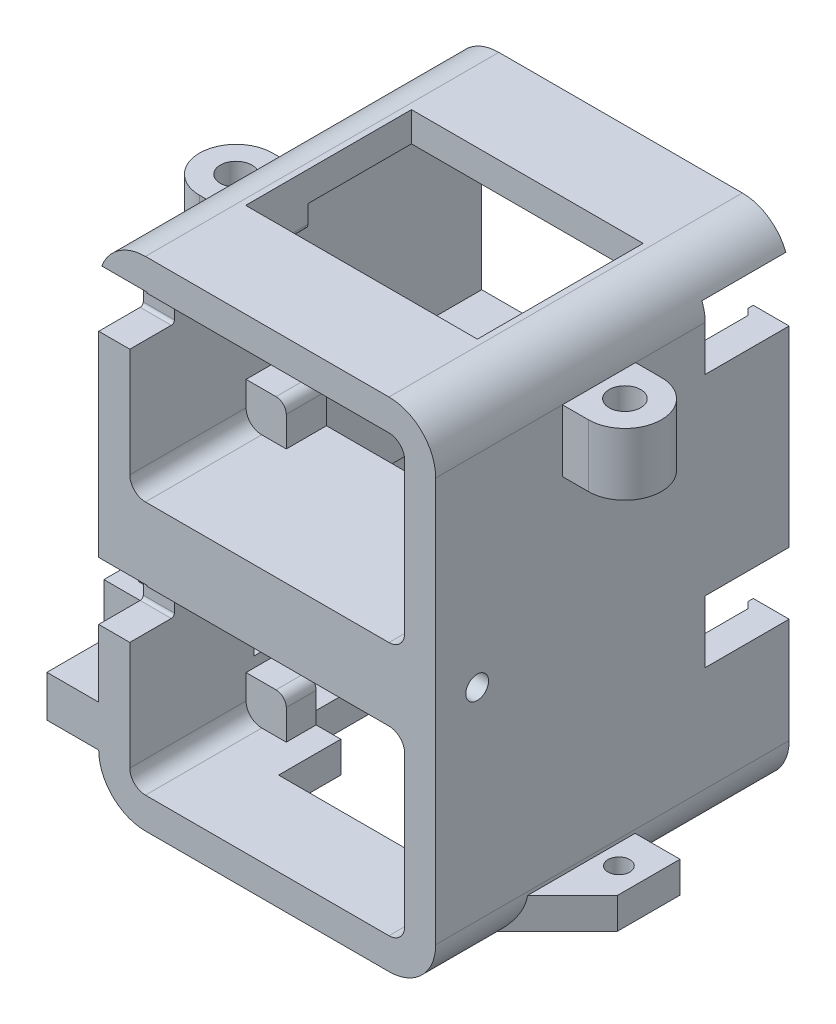
from build123d import *

# Parameters (mm, degrees)
EXTRUDE_2_DEPTH         = 11.22
EXTRUDE_3_DEPTH         = 3.88
CUT_EXTRUDE_1_DEPTH     = 4.65
SKETCH_8_R              = 3.525
SKETCH_8_R_2            = 1.525
EXTRUDE_5_DEPTH         = 6
SKETCH_9_W              = 22.36
SKETCH_9_H              = 3
CUT_EXTRUDE_3_DEPTH     = 6
SKETCH_10_W             = 21.46
SKETCH_10_H             = 6.88
CUT_EXTRUDE_4_DEPTH     = 1
CUT_EXTRUDE_5_DEPTH     = 8
SKETCH_14_W             = 6.38
SKETCH_14_H             = 10.58
EXTRUDE_7_DEPTH         = 3
SKETCH_15_W             = 26.8
SKETCH_15_H             = 42.3
EXTRUDE_42880_DEPTH     = 19
SKETCH_16_W             = 26.8
SKETCH_16_H             = 6.7
EXTRUDE_9_DEPTH         = 16
CUT_EXTRUDE_8_REACH     = 51.071
SKETCH_17_W             = 19.76
SKETCH_17_H             = 10
CUT_EXTRUDE_9_REACH     = 63.246
SKETCH_18_W             = 8.1
SKETCH_18_H             = 6
CUT_EXTRUDE_START       = -2.86
SKETCH_19_W             = 21.46
SKETCH_19_H             = 1
SKETCH_19_H_2           = 10
CUT_EXTRUDE_10_DEPTH    = 2.86
CUT_EXTRUDE_14_REACH    = 64.971
SKETCH_24_W             = 14
SKETCH_24_H             = 6
CUT_EXTRUDE_11_REACH    = 64.971
SKETCH_20_W             = 22.36
SKETCH_20_H             = 10
SKETCH_21_W             = 1.5
SKETCH_21_H             = 5
EXTRUDE_10_DEPTH        = 0.6
CHAMFER_1_SIZE          = 1
CUT_EXTRUDE_46979_REACH = 64.955
SKETCH_22_W             = 8.1
SKETCH_22_H             = 9.56
SKETCH_25_R             = 1.05
EXTRUDE_47426_DEPTH     = 3
SKETCH_26_W             = 5
SKETCH_26_H             = 4
EXTRUDE_12_DEPTH        = 7
SKETCH_27_R             = 1.05
CUT_EXTRUDE_15_DEPTH    = 57.74919682
SKETCH_30_W             = 6.32
SKETCH_30_H             = 5
EXTRUDE_13_DEPTH        = 5
CUT_EXTRUDE_16_REACH    = 58.749
SKETCH_33_W             = 1
SKETCH_33_H             = 1.5
SKETCH_34_W             = 14
SKETCH_34_H             = 1.5
EXTRUDE_14_DEPTH        = 5
FILLET_1_R              = 0.5


with BuildPart() as part:
    # 草图2 → 凸台-拉伸2 (new body)
    with BuildSketch(Plane.XY):
        with BuildLine():
            ThreePointArc((-16.26, -7.25), (-14.939051583, -10.439051583), (-11.75, -11.76))
            Line((-11.75, -11.76), (11.75, -11.76))
            ThreePointArc((11.75, -11.76), (14.939051583, -10.439051583), (16.26, -7.25))
            Line((16.26, -7.25), (16.26, 31.75))
            ThreePointArc((16.26, 31.75), (14.939051583, 34.939051583), (11.75, 36.26))
            Line((11.75, 36.26), (-11.75, 36.26))
            ThreePointArc((-11.75, 36.26), (-14.939051583, 34.939051583), (-16.26, 31.75))
            Line((-16.26, 31.75), (-16.26, -7.25))
        make_face()
        with BuildLine():
            Line((13.26, 7.25), (13.26, -7.25))
            ThreePointArc((13.26, -7.25), (12.81773124, -8.31773124), (11.75, -8.76))
            Line((11.75, -8.76), (-11.75, -8.76))
            ThreePointArc((-11.75, -8.76), (-12.81773124, -8.31773124), (-13.26, -7.25))
            Line((-13.26, -7.25), (-13.26, 7.25))
            ThreePointArc((-13.26, 7.25), (-12.81773124, 8.31773124), (-11.75, 8.76))
            Line((-11.75, 8.76), (11.75, 8.76))
            ThreePointArc((11.75, 8.76), (12.81773124, 8.31773124), (13.26, 7.25))
        make_face(mode=Mode.SUBTRACT)
        with BuildLine():
            Line((-11.75, 33.26), (11.75, 33.26))
            ThreePointArc((11.75, 33.26), (12.81773124, 32.81773124), (13.26, 31.75))
            Line((13.26, 31.75), (13.26, 17.25))
            ThreePointArc((13.26, 17.25), (12.81773124, 16.18226876), (11.75, 15.74))
            Line((11.75, 15.74), (-11.75, 15.74))
            ThreePointArc((-11.75, 15.74), (-12.81773124, 16.18226876), (-13.26, 17.25))
            Line((-13.26, 17.25), (-13.26, 31.75))
            ThreePointArc((-13.26, 31.75), (-12.81773124, 32.81773124), (-11.75, 33.26))
        make_face(mode=Mode.SUBTRACT)
    extrude(amount=-EXTRUDE_2_DEPTH)

    # 草图3 → 凸台-拉伸3 (add)
    with BuildSketch(Plane(origin=(0, 0, -11.22), x_dir=(-1, 0, 0), z_dir=(0, 0, -1))):
        with BuildLine():
            ThreePointArc((11.75, -11.76), (14.939051583, -10.439051583), (16.26, -7.25))
            Line((16.26, -7.25), (16.26, 31.75))
            ThreePointArc((16.26, 31.75), (14.939051583, 34.939051583), (11.75, 36.26))
            Line((11.75, 36.26), (-11.75, 36.26))
            ThreePointArc((-11.75, 36.26), (-14.939051583, 34.939051583), (-16.26, 31.75))
            Line((-16.26, 31.75), (-16.26, -7.25))
            ThreePointArc((-16.26, -7.25), (-14.939051583, -10.439051583), (-11.75, -11.76))
            Line((-11.75, -11.76), (11.75, -11.76))
        make_face()
        with BuildLine():
            Line((13.26, -4.88), (10.37, -4.88))
            ThreePointArc((10.37, -4.88), (9.669964287, -5.169964287), (9.38, -5.87))
            Line((9.38, -5.87), (9.38, -8.76))
            Line((9.38, -8.76), (-9.38, -8.76))
            Line((-9.38, -8.76), (-9.38, -5.87))
            ThreePointArc((-9.38, -5.87), (-9.669964287, -5.169964287), (-10.37, -4.88))
            Line((-10.37, -4.88), (-13.26, -4.88))
            Line((-13.26, -4.88), (-13.26, 6.68))
            Line((-13.26, 6.68), (-11.67, 6.68))
            ThreePointArc((-11.67, 6.68), (-11.323517677, 6.823517677), (-11.18, 7.17))
            Line((-11.18, 7.17), (-11.18, 8.76))
            Line((-11.18, 8.76), (11.18, 8.76))
            Line((11.18, 8.76), (11.18, 7.17))
            ThreePointArc((11.18, 7.17), (11.323517677, 6.823517677), (11.67, 6.68))
            Line((11.67, 6.68), (13.26, 6.68))
            Line((13.26, 6.68), (13.26, -4.88))
        make_face(mode=Mode.SUBTRACT)
        with BuildLine():
            Line((13.26, 31.18), (13.26, 19.62))
            Line((13.26, 19.62), (10.37, 19.62))
            ThreePointArc((10.37, 19.62), (9.669964287, 19.330035713), (9.38, 18.63))
            Line((9.38, 18.63), (9.38, 15.74))
            Line((9.38, 15.74), (-9.38, 15.74))
            Line((-9.38, 15.74), (-9.38, 18.63))
            ThreePointArc((-9.38, 18.63), (-9.669964287, 19.330035713), (-10.37, 19.62))
            Line((-10.37, 19.62), (-13.26, 19.62))
            Line((-13.26, 19.62), (-13.26, 31.18))
            Line((-13.26, 31.18), (-11.67, 31.18))
            ThreePointArc((-11.67, 31.18), (-11.323517677, 31.323517677), (-11.18, 31.67))
            Line((-11.18, 31.67), (-11.18, 33.26))
            Line((-11.18, 33.26), (11.18, 33.26))
            Line((11.18, 33.26), (11.18, 31.67))
            ThreePointArc((11.18, 31.67), (11.323517677, 31.323517677), (11.67, 31.18))
            Line((11.67, 31.18), (13.26, 31.18))
        make_face(mode=Mode.SUBTRACT)
    extrude(amount=EXTRUDE_3_DEPTH)

    # 草图4 → 切除-拉伸1 (cut)
    with BuildSketch(Plane.ZY.offset(16.26)):
        with BuildLine():
            Line((0.1, 8.85), (-4, 8.85))
            ThreePointArc((-4, 8.85), (-4.212132034, 8.762132034), (-4.3, 8.55))
            Line((-4.3, 8.55), (-4.3, 3.55))
            ThreePointArc((-4.3, 3.55), (-4.212132034, 3.337867966), (-4, 3.25))
            Line((-4, 3.25), (0.1, 3.25))
            Line((0.1, 3.25), (0.1, 8.85))
        make_face()
        with BuildLine():
            Line((0.1, 33.35), (-4, 33.35))
            ThreePointArc((-4, 33.35), (-4.212132034, 33.262132034), (-4.3, 33.05))
            Line((-4.3, 33.05), (-4.3, 28.05))
            ThreePointArc((-4.3, 28.05), (-4.212132034, 27.837867966), (-4, 27.75))
            Line((-4, 27.75), (0.1, 27.75))
            Line((0.1, 27.75), (0.1, 33.35))
        make_face()
    extrude(amount=-CUT_EXTRUDE_1_DEPTH, mode=Mode.SUBTRACT)

    # 草图8 → 凸台-拉伸5 (add)
    # profile 1 of 3: a face of its own
    with BuildSketch(Plane(origin=(0, 31.75, 0), x_dir=(1, 0, 0), z_dir=(0, 1, 0))):
        with Locations((18.76, 15.755)):
            Circle(SKETCH_8_R)
        with Locations(Location((18.76, 15.755, 0), (0, 0, 270))):
            Circle(SKETCH_8_R_2, mode=Mode.SUBTRACT)
    # profile 2 of 3: a face of its own
    with BuildSketch(Plane(origin=(0, 31.75, 0), x_dir=(1, 0, 0), z_dir=(0, 1, 0))):
        with BuildLine():
            Line((15.235, 19.28), (15.235, 15.755))
            ThreePointArc((15.235, 15.755), (16.267448596, 18.247551404), (18.76, 19.28))
            Line((18.76, 19.28), (15.235, 19.28))
        make_face()
    # profile 3 of 3: a face of its own
    with BuildSketch(Plane(origin=(0, 31.75, 0), x_dir=(1, 0, 0), z_dir=(0, 1, 0))):
        with BuildLine():
            Line((15.235, 12.23), (18.76, 12.23))
            ThreePointArc((18.76, 12.23), (16.267448596, 13.262448596), (15.235, 15.755))
            Line((15.235, 15.755), (15.235, 12.23))
        make_face()
    extrude_5 = extrude(amount=-EXTRUDE_5_DEPTH)

    # 镜向1: 凸台-拉伸5 across plane
    add(extrude_5.mirror(Plane(origin=(0, 0, 0), x_dir=(0, 0, 1), z_dir=(1, 0, 0))))

    # 草图9 → 切除-拉伸3 (cut)
    with BuildSketch(Plane(origin=(0, 0, -15.1), x_dir=(-1, 0, 0), z_dir=(0, 0, -1))):
        with Locations((0, 34.76)):
            Rectangle(SKETCH_9_W, SKETCH_9_H)
    extrude(amount=-CUT_EXTRUDE_3_DEPTH, mode=Mode.SUBTRACT)

    # 草图10 → 切除-拉伸4 (cut)
    with BuildSketch(Plane(origin=(0, 0, -15.1), x_dir=(-1, 0, 0), z_dir=(0, 0, -1))):
        with Locations((0, -8.32)):
            Rectangle(SKETCH_10_W, SKETCH_10_H)
    extrude(amount=-CUT_EXTRUDE_4_DEPTH, mode=Mode.SUBTRACT)

    # 草图12 → 切除-拉伸5 (cut)
    with BuildSketch(Plane.ZY.offset(16.26)):
        with BuildLine():
            ThreePointArc((-2.9, 12.25), (-4, 13.35), (-5.1, 12.25))
            Line((-5.1, 12.25), (-2.9, 12.25))
        make_face()
        with BuildLine():
            Line((-2.9, 12.25), (-5.1, 12.25))
            ThreePointArc((-5.1, 12.25), (-4, 11.15), (-2.9, 12.25))
        make_face()
    cut_extrude_5 = extrude(amount=-CUT_EXTRUDE_5_DEPTH, mode=Mode.SUBTRACT)

    # 镜向2: 切除-拉伸5 across plane
    add(cut_extrude_5.mirror(Plane(origin=(0, 0, 0), x_dir=(0, 0, 1), z_dir=(1, 0, 0))), mode=Mode.SUBTRACT)

    # 草图14 → 凸台-拉伸7 (add)
    with BuildSketch(Plane(origin=(0, 0, -15.1), x_dir=(-1, 0, 0), z_dir=(0, 0, -1))):
        with Locations((-13.07, 14.19)):
            Rectangle(SKETCH_14_W, SKETCH_14_H)
        with Locations((13.07, 14.19)):
            Rectangle(SKETCH_14_W, SKETCH_14_H)
    extrude(amount=EXTRUDE_7_DEPTH)

    # 草图15 → Extrude 42880 (add)
    with BuildSketch(Plane(origin=(0, 0, -15.1), x_dir=(-1, 0, 0), z_dir=(0, 0, -1))):
        with BuildLine():
            Line((-16.26, 31.75), (-16.26, 19.48))
            Line((-16.26, 19.48), (-16.26, 8.9))
            Line((-16.26, 8.9), (-16.26, -7.25))
            ThreePointArc((-16.26, -7.25), (-14.939051583, -10.439051583), (-11.75, -11.76))
            Line((-11.75, -11.76), (11.75, -11.76))
            ThreePointArc((11.75, -11.76), (14.939051583, -10.439051583), (16.26, -7.25))
            Line((16.26, -7.25), (16.26, 8.9))
            Line((16.26, 8.9), (16.26, 19.48))
            Line((16.26, 19.48), (16.26, 31.75))
            ThreePointArc((16.26, 31.75), (14.939051583, 34.939051583), (11.75, 36.26))
            Line((11.75, 36.26), (-11.75, 36.26))
            ThreePointArc((-11.75, 36.26), (-14.939051583, 34.939051583), (-16.26, 31.75))
        make_face()
        with Locations((0, 12.25)):
            Rectangle(SKETCH_15_W, SKETCH_15_H, mode=Mode.SUBTRACT)
    extrude(amount=EXTRUDE_42880_DEPTH)

    # 草图16 → 凸台-拉伸9 (add)
    with BuildSketch(Plane(origin=(0, 0, -18.1), x_dir=(-1, 0, 0), z_dir=(0, 0, -1))):
        with Locations((0, 12.25)):
            Rectangle(SKETCH_16_W, SKETCH_16_H)
    extrude(amount=EXTRUDE_9_DEPTH)

    # 草图17 → 切除-拉伸8 (cut, up to next)
    with BuildSketch(Plane.XZ.offset(-8.9), mode=Mode.PRIVATE) as cut_extrude_8_sk1:
        with Locations((0, -23.1)):
            Rectangle(SKETCH_17_W, SKETCH_17_H)
    cut_extrude_8_tool1 = extrude(cut_extrude_8_sk1.sketch, amount=-CUT_EXTRUDE_8_REACH, mode=Mode.PRIVATE) & part.part
    add(cut_extrude_8_tool1.solids().sort_by_distance((0, 8.9, -23.1))[0], mode=Mode.SUBTRACT)

    # 草图18 → 切除-拉伸9 (cut, up to next)
    with BuildSketch(Plane.ZY.offset(-13.4), mode=Mode.PRIVATE) as cut_extrude_9_sk1:
        with Locations((-30.05, 5.9)):
            Rectangle(SKETCH_18_W, SKETCH_18_H)
    cut_extrude_9_tool1 = extrude(cut_extrude_9_sk1.sketch, amount=-CUT_EXTRUDE_9_REACH, mode=Mode.PRIVATE) & part.part
    # 草图18 → 切除-拉伸9 (cut, up to next)
    with BuildSketch(Plane.ZY.offset(-13.4), mode=Mode.PRIVATE) as cut_extrude_9_sk2:
        with Locations((-30.05, 30.4)):
            Rectangle(SKETCH_18_W, SKETCH_18_H)
    cut_extrude_9_tool2 = extrude(cut_extrude_9_sk2.sketch, amount=-CUT_EXTRUDE_9_REACH, mode=Mode.PRIVATE) & part.part
    add(cut_extrude_9_tool1.solids().sort_by_distance((13.4, 5.9, -30.05))[0], mode=Mode.SUBTRACT)
    add(cut_extrude_9_tool2.solids().sort_by_distance((13.4, 30.4, -30.05))[0], mode=Mode.SUBTRACT)

    # 草图19 → 切除-拉伸10 (cut)
    with BuildSketch(Plane.XZ.offset(11.76).offset(CUT_EXTRUDE_START)):
        with Locations((0, -14.6)):
            Rectangle(SKETCH_19_W, SKETCH_19_H)
        with Locations((0, -20.1)):
            Rectangle(SKETCH_19_W, SKETCH_19_H_2)
    extrude(amount=CUT_EXTRUDE_10_DEPTH, mode=Mode.SUBTRACT)

    # 草图24 → 切除-拉伸14 (cut, up to next)
    with BuildSketch(Plane.XZ.offset(11.76), mode=Mode.PRIVATE) as cut_extrude_14_sk1:
        with Locations((0, -11.1)):
            Rectangle(SKETCH_24_W, SKETCH_24_H)
    cut_extrude_14_tool1 = extrude(cut_extrude_14_sk1.sketch, amount=-CUT_EXTRUDE_14_REACH, mode=Mode.PRIVATE) & part.part
    add(cut_extrude_14_tool1.solids().sort_by_distance((0, -11.76, -11.1))[0], mode=Mode.SUBTRACT)

    # 草图20 → 切除-拉伸11 (cut, up to next)
    with BuildSketch(Plane(origin=(0, 36.26, 0), x_dir=(1, 0, 0), z_dir=(0, 1, 0)), mode=Mode.PRIVATE) as cut_extrude_11_sk1:
        with Locations((0, 20.1)):
            Rectangle(SKETCH_20_W, SKETCH_20_H)
    cut_extrude_11_tool1 = extrude(cut_extrude_11_sk1.sketch, amount=-CUT_EXTRUDE_11_REACH, mode=Mode.PRIVATE) & part.part
    add(cut_extrude_11_tool1.solids().sort_by_distance((0, 36.26, -20.1))[0], mode=Mode.SUBTRACT)

    # 草图21 → 凸台-拉伸10 (add)
    with BuildSketch(Plane.ZY.offset(-13.4)):
        with Locations((-33.35, 24.9)):
            Rectangle(SKETCH_21_W, SKETCH_21_H)
        with Locations((-33.35, 0.4)):
            Rectangle(SKETCH_21_W, SKETCH_21_H)
    extrude(amount=EXTRUDE_10_DEPTH)

    # 倒角1
    # the kernel refuses this chamfer: 1 mm, written as the material it takes off along each edge
    with BuildSketch(Plane(origin=(12.8, 5.471682988, -32.6), x_dir=(-0.02749587661058555, 0, -0.9996219169112968), z_dir=(0, -1, 0))) as chamfer_1_piece_1_section:
        Polygon((CHAMFER_1_SIZE * 0.999621916911, CHAMFER_1_SIZE * 0.0274958766106), (-CHAMFER_1_SIZE * 0.0274958766106, CHAMFER_1_SIZE * 0.999621916911), (0, 0), align=None)
    chamfer_1_piece_1 = extrude(amount=10.143365976, mode=Mode.PRIVATE)
    chamfer_1_piece_1 = split(chamfer_1_piece_1, bisect_by=Plane(origin=(13.4, 0.4, -32.97500946), z_dir=(-1, 0, 0)), keep=Keep.TOP, mode=Mode.PRIVATE)
    add(chamfer_1_piece_1, mode=Mode.SUBTRACT)
    with BuildSketch(Plane(origin=(12.8, 29.971682988, -32.6), x_dir=(-0.02749587661058555, 0, -0.9996219169112968), z_dir=(0, -1, 0))) as chamfer_1_piece_2_section:
        Polygon((CHAMFER_1_SIZE * 0.999621916911, CHAMFER_1_SIZE * 0.0274958766106), (-CHAMFER_1_SIZE * 0.0274958766106, CHAMFER_1_SIZE * 0.999621916911), (0, 0), align=None)
    chamfer_1_piece_2 = extrude(amount=10.143365976, mode=Mode.PRIVATE)
    chamfer_1_piece_2 = split(chamfer_1_piece_2, bisect_by=Plane(origin=(13.4, 24.9, -32.97500946), z_dir=(-1, 0, 0)), keep=Keep.TOP, mode=Mode.PRIVATE)
    add(chamfer_1_piece_2, mode=Mode.SUBTRACT)

    # 草图22 → Cut-Extrude 46979 (cut, up to next)
    with BuildSketch(Plane.ZY.offset(16.26), mode=Mode.PRIVATE) as cut_extrude_46979_sk1:
        with Locations((-16.05, 0.9)):
            Rectangle(SKETCH_22_W, SKETCH_22_H)
    cut_extrude_46979_tool1 = extrude(cut_extrude_46979_sk1.sketch, amount=-CUT_EXTRUDE_46979_REACH, mode=Mode.PRIVATE) & part.part
    add(cut_extrude_46979_tool1.solids().sort_by_distance((-16.26, 0.9, -16.05))[0], mode=Mode.SUBTRACT)

    # 草图25 → Extrude 47426 (add)
    with BuildSketch(Plane(origin=(0, -10.58, 0), x_dir=(1, 0, 0), z_dir=(0, 1, 0))):
        Polygon((20.58, 19.255), (14.58, 19.255), (14.58, 7.205252532), (20.58, 13.205252532), align=None)
        with Locations(Location((18.18, 15.755, 0), (0, 0, 180))):
            Circle(SKETCH_25_R, mode=Mode.SUBTRACT)
    extrude(amount=EXTRUDE_47426_DEPTH)

    # 草图26 → 凸台-拉伸12 (add)
    with BuildSketch(Plane.XY):
        with Locations((-18.76, -5.25)):
            Rectangle(SKETCH_26_W, SKETCH_26_H)
    extrude(amount=-EXTRUDE_12_DEPTH)

    # 草图27 → 切除-拉伸15 (cut, through all)
    with BuildSketch(Plane(origin=(0, -3.25, 0), x_dir=(1, 0, 0), z_dir=(0, 1, 0))):
        with Locations(Location((-17.76, 3.5, 0), (0, 0, 180))):
            Circle(SKETCH_27_R)
    extrude(amount=-CUT_EXTRUDE_15_DEPTH, mode=Mode.SUBTRACT)

    # 草图30 → 凸台-拉伸13 (add)
    with BuildSketch(Plane.ZY.offset(16.26)):
        with Locations((-8.66, -0.75)):
            Rectangle(SKETCH_30_W, SKETCH_30_H)
    extrude(amount=EXTRUDE_13_DEPTH)

    # 草图33 → 切除-拉伸16 (cut, up to next)
    with BuildSketch(Plane.XZ.offset(3.25), mode=Mode.PRIVATE) as cut_extrude_16_sk1:
        with Locations((-16.76, -11.07)):
            Rectangle(SKETCH_33_W, SKETCH_33_H)
    cut_extrude_16_tool1 = extrude(cut_extrude_16_sk1.sketch, amount=-CUT_EXTRUDE_16_REACH, mode=Mode.PRIVATE) & part.part
    # 草图33 → 切除-拉伸16 (cut, up to next)
    with BuildSketch(Plane.XZ.offset(3.25), mode=Mode.PRIVATE) as cut_extrude_16_sk2:
        Polygon((-19.76, -7), (-19.76, -10.32), (-17.26, -10.32), (-16.26, -10.32), (-16.26, -7), align=None)
    cut_extrude_16_tool2 = extrude(cut_extrude_16_sk2.sketch, amount=-CUT_EXTRUDE_16_REACH, mode=Mode.PRIVATE) & part.part
    add(cut_extrude_16_tool1.solids().sort_by_distance((-16.76, -3.25, -11.07))[0], mode=Mode.SUBTRACT)
    add(cut_extrude_16_tool2.solids().sort_by_distance((-18.01, -3.25, -8.66))[0], mode=Mode.SUBTRACT)

    # 草图34 → 凸台-拉伸14 (add)
    with BuildSketch(Plane.XZ.offset(11.76)):
        with Locations((0, -7.35)):
            Rectangle(SKETCH_34_W, SKETCH_34_H)
    extrude(amount=EXTRUDE_14_DEPTH)

    # 圆角1
    fillet_1_edges = [part.edges().sort_by_distance(p)[0] for p in [
        (-21.26, -0.75, -11.82),
        (-17.26, -0.75, -11.82),
        (-17.26, -0.75, -10.32),
        (-19.76, -0.75, -10.32),
        (-19.76, -0.75, -7),
        (0, -11.76, -6.6),
        (0, -16.76, -6.6),
        (0, -16.76, -8.1),
    ]]
    fillet(fillet_1_edges, radius=FILLET_1_R)


solid = part.part
